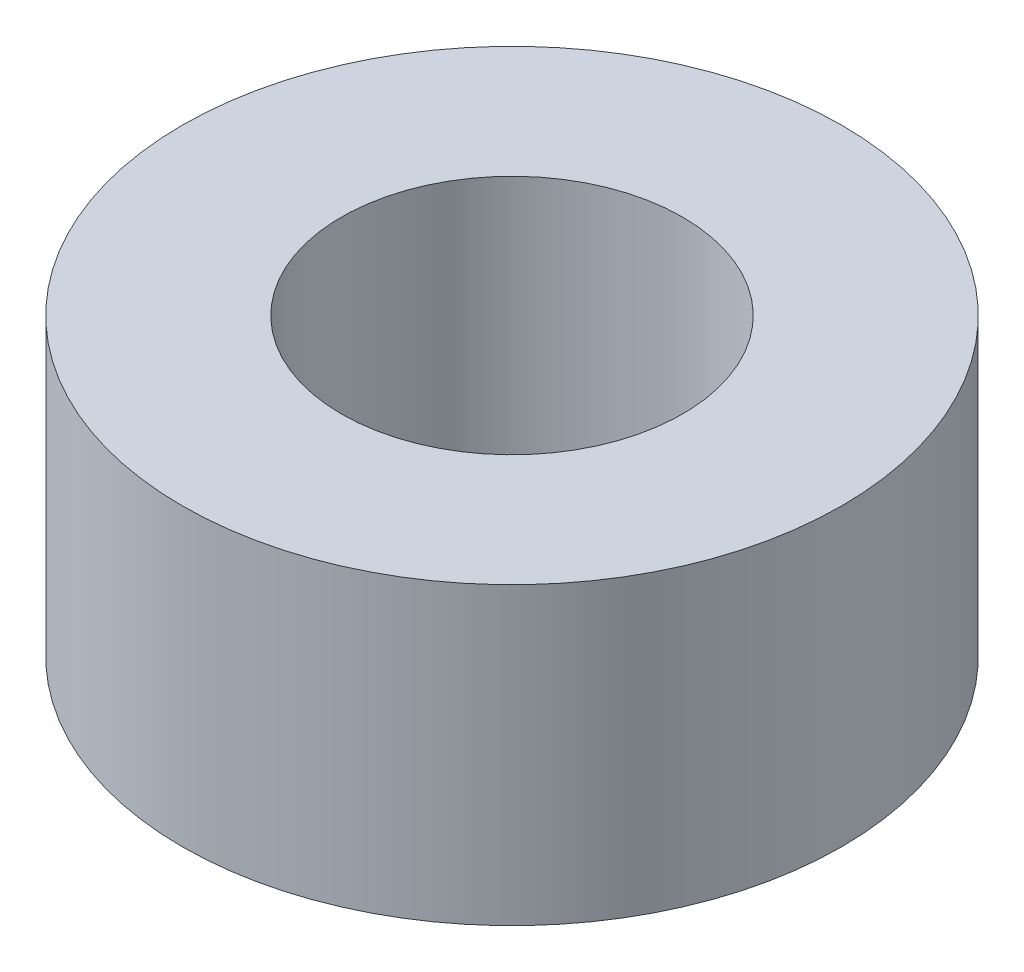
from build123d import *

# Parameters (mm, degrees)
SKETCH1_R           = 10
BOSS_EXTRUDE1_DEPTH = 8.955912889
SKETCH2_R           = 5.173957371
CUT_EXTRUDE1_DEPTH  = 17.739425787


with BuildPart() as part:
    # Sketch1 → Boss-Extrude1 (new body)
    with BuildSketch(Plane(origin=(0, 0, 0), x_dir=(1, 0, 0), z_dir=(0, 1, 0))):
        Circle(SKETCH1_R)
    extrude(amount=BOSS_EXTRUDE1_DEPTH)

    # Sketch2 → Cut-Extrude1 (cut, through all)
    with BuildSketch(Plane(origin=(0, 0, 0), x_dir=(1, 0, 0), z_dir=(0, 1, 0))):
        Circle(SKETCH2_R)
    extrude(amount=CUT_EXTRUDE1_DEPTH, mode=Mode.SUBTRACT)


solid = part.part
